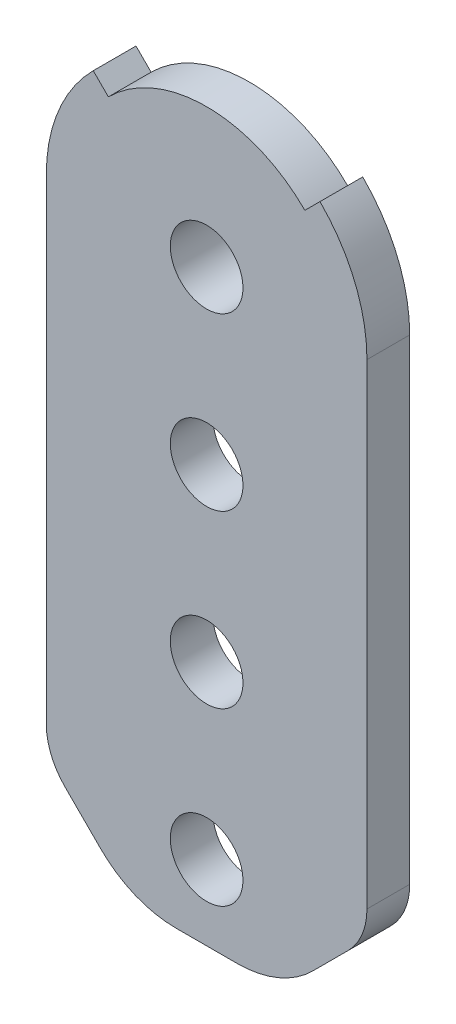
from build123d import *
from build123d.topology import SkipClean

# Parameters (mm, degrees)
SKETCH1_R                 = 1.7
BOSS_EXTRUDE1_DEPTH       = 2
BOSS_EXTRUDE2_START       = -4.3
BOSS_EXTRUDE2_DEPTH       = 4.3
BOSS_EXTRUDE3_START       = 2
BOSS_EXTRUDE3_DEPTH       = 2
SKETCH3_R                 = 1.7
CUT_EXTRUDE2_DEPTH        = 2
FILLET1_R                 = 0.5
FILLET2_R                 = 0.5
FILLET3_R                 = 1.5
FILLET4_R                 = 0.5
SKETCH5_R                 = 15.029475961
CUT_EXTRUDE3_DEPTH        = 10
CUT_EXTRUDE4_DEPTH        = 10
BOSS_EXTRUDE4_START       = 0.5
SKETCH7_R                 = 2.25
SKETCH7_R_2               = 1.7
BOSS_EXTRUDE4_DEPTH       = 0.5
CHAMFER2_SIZE             = 0.5
CUT_EXTRUDE7_DEPTH        = 31.987900865
BOSS_EXTRUDE5_DEPTH       = 2
FILLET7_R                 = 5
FILLET8_R                 = 1
FILLET9_R                 = 3
BOSS_EXTRUDE6_START       = -2
BOSS_EXTRUDE6_OUTLINE_R   = 1.7
BOSS_EXTRUDE6_OUTLINE_R_2 = 2.75
BOSS_EXTRUDE6_DEPTH       = 2


with BuildPart() as part:
    # Sketch1 → Boss-Extrude1 (new body)
    with BuildSketch(Plane.XY):
        with BuildLine():
            Line((-7.5, 0), (-7.5, -30))
            Line((-7.5, -30), (7.5, -30))
            Line((7.5, -30), (7.5, 0))
            ThreePointArc((7.5, 0), (0, 7.5), (-7.5, 0))
        make_face()
        Circle(SKETCH1_R, mode=Mode.SUBTRACT)
    extrude(amount=BOSS_EXTRUDE1_DEPTH)

    # Sketch1<3> → Boss-Extrude2 (add)
    with BuildSketch(Plane.XY.offset(BOSS_EXTRUDE2_START)):
        with BuildLine():
            ThreePointArc((5.303300859, 5.303300859), (0, 7.5), (-5.303300859, 5.303300859))
            Line((-5.303300859, 5.303300859), (-4.419417382, 4.419417382))
            ThreePointArc((-4.419417382, 4.419417382), (0, 6.25), (4.419417382, 4.419417382))
            Line((4.419417382, 4.419417382), (5.303300859, 5.303300859))
        make_face()
    extrude(amount=BOSS_EXTRUDE2_DEPTH)

    # Sketch2 → Boss-Extrude3 (add)
    with BuildSketch(Plane(origin=(0, 0, -4.3), x_dir=(-1, 0, 0), z_dir=(0, 0, -1)).offset(BOSS_EXTRUDE3_START)):
        with BuildLine():
            ThreePointArc((-0.842733725, 2.879201255), (-2.631805464, 1.44), (-2.879201255, -0.842733725))
            ThreePointArc((-2.879201255, -0.842733725), (0, -3), (2.879201255, -0.842733725))
            ThreePointArc((2.879201255, -0.842733725), (2.969646761, -0.425673721), (3, 0))
            ThreePointArc((3, 0), (2.400854137, 1.798860587), (0.842733725, 2.879201255))
            Line((0.842733725, 2.879201255), (0.477549111, 1.631547378))
            ThreePointArc((0.477549111, 1.631547378), (1.360484011, 1.019354333), (1.7, 0))
            ThreePointArc((1.7, 0), (-1.019354333, -1.360484011), (-0.477549111, 1.631547378))
            Line((-0.477549111, 1.631547378), (-0.842733725, 2.879201255))
        make_face()
        with BuildLine():
            ThreePointArc((0.842733725, 2.879201255), (0, 3), (-0.842733725, 2.879201255))
            Line((-0.842733725, 2.879201255), (-0.477549111, 1.631547378))
            ThreePointArc((-0.477549111, 1.631547378), (0, 1.7), (0.477549111, 1.631547378))
            Line((0.477549111, 1.631547378), (0.842733725, 2.879201255))
        make_face()
        with BuildLine():
            ThreePointArc((-1.755695261, 5.998335948), (-3.186887196, 5.376453292), (-4.419417382, 4.419417382))
            Line((-4.419417382, 4.419417382), (-2.879201255, -0.842733725))
            ThreePointArc((-2.879201255, -0.842733725), (-2.631805464, 1.44), (-0.842733725, 2.879201255))
            Line((-0.842733725, 2.879201255), (-1.755695261, 5.998335948))
        make_face()
        with BuildLine():
            ThreePointArc((3, 0), (2.969646761, -0.425673721), (2.879201255, -0.842733725))
            Line((2.879201255, -0.842733725), (4.419417382, 4.419417382))
            ThreePointArc((4.419417382, 4.419417382), (3.186887196, 5.376453292), (1.755695261, 5.998335948))
            Line((1.755695261, 5.998335948), (0.842733725, 2.879201255))
            ThreePointArc((0.842733725, 2.879201255), (2.400854137, 1.798860587), (3, 0))
        make_face()
        with BuildLine():
            Line((-5.303300859, 5.303300859), (-4.419417382, 4.419417382))
            ThreePointArc((-4.419417382, 4.419417382), (-3.186887196, 5.376453292), (-1.755695261, 5.998335948))
            ThreePointArc((-1.755695261, 5.998335948), (0, 6.25), (1.755695261, 5.998335948))
            ThreePointArc((1.755695261, 5.998335948), (3.186887196, 5.376453292), (4.419417382, 4.419417382))
            Line((4.419417382, 4.419417382), (5.303300859, 5.303300859))
            ThreePointArc((5.303300859, 5.303300859), (0, 7.5), (-5.303300859, 5.303300859))
        make_face()
    extrude(amount=-BOSS_EXTRUDE3_DEPTH)

    # Sketch3 → Cut-Extrude2 (cut)
    with BuildSketch(Plane(origin=(0, 0, 0), x_dir=(-1, 0, 0), z_dir=(0, 0, -1))):
        with Locations((0, -8)):
            Circle(SKETCH3_R)
        with Locations((0, -16)):
            Circle(SKETCH3_R)
        with Locations((0, -24)):
            Circle(SKETCH3_R)
        Polygon((-6, -18.5), (-3.1875, -20), (-6, -21.5), align=None)
        Polygon((-6, -10.5), (-3.1875, -12), (-6, -13.5), align=None)
        Polygon((6, -13.5), (3.1875, -12), (6, -10.5), align=None)
        Polygon((6, -21.5), (3.1875, -20), (6, -18.5), align=None)
    extrude(amount=-CUT_EXTRUDE2_DEPTH, mode=Mode.SUBTRACT)

    # Fillet1
    fillet1_edges = [part.edges().sort_by_distance(p)[0] for p in [
        (-3.1875, -20, 1),
        (-6, -18.5, 1),
        (6, -18.5, 1),
        (3.1875, -20, 1),
        (6, -21.5, 1),
        (6, -10.5, 1),
        (3.1875, -12, 1),
        (6, -13.5, 1),
        (-6, -13.5, 1),
        (-3.1875, -12, 1),
        (-6, -10.5, 1),
        (-6, -21.5, 1),
    ]]
    fillet(fillet1_edges, radius=FILLET1_R)

    # Fillet2
    fillet2_edges = [part.edges().sort_by_distance(p)[0] for p in [
        (5.303300859, 5.303300859, -3.15),
        (4.419417382, 4.419417382, -2.15),
        (-4.419417382, 4.419417382, -2.15),
        (-5.303300859, 5.303300859, -3.15),
    ]]
    fillet(fillet2_edges, radius=FILLET2_R)

    # Fillet3
    fillet3_edges = [part.edges().sort_by_distance(p)[0] for p in [
        (-4.419417382, 4.419417382, -5.3),
        (4.419417382, 4.419417382, -5.3),
    ]]
    fillet(fillet3_edges, radius=FILLET3_R)

    # Fillet4
    fillet4_edges = [part.edges().sort_by_distance(p)[0] for p in [
        (-0.842733725, 2.879201255, -5.3),
        (0.842733725, 2.879201255, -5.3),
        (1.755695261, 5.998335948, -5.3),
        (-1.755695261, 5.998335948, -5.3),
    ]]
    fillet(fillet4_edges, radius=FILLET4_R)

    # Sketch5 → Cut-Extrude3 (cut)
    with BuildSketch(Plane(origin=(0, 0, 0), x_dir=(-1, 0, 0), z_dir=(0, 0, -1))):
        Circle(SKETCH5_R)
    extrude(amount=CUT_EXTRUDE3_DEPTH, mode=Mode.SUBTRACT)

    # Sketch6 → Cut-Extrude4 (cut)
    with BuildSketch(Plane(origin=(0, 0, 0), x_dir=(-1, 0, 0), z_dir=(0, 0, -1))):
        with BuildLine():
            Line((-5.303300859, 5.303300859), (-4.596194078, 4.596194078))
            ThreePointArc((-4.596194078, 4.596194078), (0, 6.5), (4.596194078, 4.596194078))
            Line((4.596194078, 4.596194078), (5.303300859, 5.303300859))
            ThreePointArc((5.303300859, 5.303300859), (0, 7.5), (-5.303300859, 5.303300859))
        make_face()
    extrude(amount=-CUT_EXTRUDE4_DEPTH, mode=Mode.SUBTRACT)

    # Sketch7 → Boss-Extrude4 (add)
    with SkipClean():  # the faces are left unmerged after this step: merging them gives an invalid solid
        with BuildSketch(Plane(origin=(0, 0, 0), x_dir=(-1, 0, 0), z_dir=(0, 0, -1)).offset(BOSS_EXTRUDE4_START)):
            with Locations(Location((0, 0, 0), (0, 0, 180))):
                Circle(SKETCH7_R)
            Circle(SKETCH7_R_2, mode=Mode.SUBTRACT)
        extrude(amount=-BOSS_EXTRUDE4_DEPTH)

    # Chamfer2
    chamfer2_edges = [part.edges().sort_by_distance(p)[0] for p in [
        (-2.25, 0, 0),
    ]]
    chamfer(chamfer2_edges, length=CHAMFER2_SIZE - 0.0001)  # a hair under: the kernel refuses the full size

    # Sketch4 → Cut-Extrude7 (cut, through all)
    # profile 1 of 3: a face of its own
    with BuildSketch(Plane(origin=(0, 0, 0), x_dir=(-1, 0, 0), z_dir=(0, 0, -1))):
        with BuildLine():
            Line((-4.014705882, -20.441176471), (-3.5, -20.166666667))
            Line((-3.5, -20.166666667), (-3.5, -11.833333333))
            Line((-3.5, -11.833333333), (-3.5, -5.7))
            Line((-3.5, -5.7), (-7.5, -1.7))
            Line((-7.5, -1.7), (-7.5, -22.3))
            Line((-7.5, -22.3), (-5.264705882, -21.107843137))
            ThreePointArc((-5.264705882, -21.107843137), (-5.757247878, -21.09541313), (-6, -20.666666667))
            Line((-6, -20.666666667), (-6, -19.333333333))
            ThreePointArc((-6, -19.333333333), (-5.757247878, -18.90458687), (-5.264705882, -18.892156863))
            Line((-5.264705882, -18.892156863), (-4.014705882, -19.558823529))
            ThreePointArc((-4.014705882, -19.558823529), (-3.75, -20), (-4.014705882, -20.441176471))
        make_face()
        with BuildLine():
            ThreePointArc((-5.264705882, -13.107843137), (-5.757247878, -13.09541313), (-6, -12.666666667))
            Line((-6, -12.666666667), (-6, -11.333333333))
            ThreePointArc((-6, -11.333333333), (-5.757247878, -10.90458687), (-5.264705882, -10.892156863))
            Line((-5.264705882, -10.892156863), (-4.014705882, -11.558823529))
            ThreePointArc((-4.014705882, -11.558823529), (-3.75, -12), (-4.014705882, -12.441176471))
            Line((-4.014705882, -12.441176471), (-5.264705882, -13.107843137))
        make_face(mode=Mode.SUBTRACT)
    # profile 2 of 3: a face of its own
    with BuildSketch(Plane(origin=(0, 0, 0), x_dir=(-1, 0, 0), z_dir=(0, 0, -1))):
        with BuildLine():
            Line((-3.5, -24), (-3.5, -20.166666667))
            Line((-3.5, -20.166666667), (-4.014705882, -20.441176471))
            Line((-4.014705882, -20.441176471), (-5.264705882, -21.107843137))
            Line((-5.264705882, -21.107843137), (-7.5, -22.3))
            Line((-7.5, -22.3), (-7.5, -30))
            Line((-7.5, -30), (7.5, -30))
            Line((7.5, -30), (7.5, -22.3))
            Line((7.5, -22.3), (5.264705882, -21.107843137))
            Line((5.264705882, -21.107843137), (4.014705882, -20.441176471))
            Line((4.014705882, -20.441176471), (3.5, -20.166666667))
            Line((3.5, -20.166666667), (3.5, -24))
            ThreePointArc((3.5, -24), (0, -27.5), (-3.5, -24))
        make_face()
    # profile 3 of 3: a face of its own
    with BuildSketch(Plane(origin=(0, 0, 0), x_dir=(-1, 0, 0), z_dir=(0, 0, -1))):
        with BuildLine():
            Line((3.5, -11.833333333), (3.5, -20.166666667))
            Line((3.5, -20.166666667), (4.014705882, -20.441176471))
            ThreePointArc((4.014705882, -20.441176471), (3.75, -20), (4.014705882, -19.558823529))
            Line((4.014705882, -19.558823529), (5.264705882, -18.892156863))
            ThreePointArc((5.264705882, -18.892156863), (5.757247878, -18.90458687), (6, -19.333333333))
            Line((6, -19.333333333), (6, -20.666666667))
            ThreePointArc((6, -20.666666667), (5.757247878, -21.09541313), (5.264705882, -21.107843137))
            Line((5.264705882, -21.107843137), (7.5, -22.3))
            Line((7.5, -22.3), (7.5, -1.7))
            Line((7.5, -1.7), (3.5, -5.7))
            Line((3.5, -5.7), (3.5, -11.833333333))
        make_face()
        with BuildLine():
            ThreePointArc((5.264705882, -10.892156863), (5.757247878, -10.90458687), (6, -11.333333333))
            Line((6, -11.333333333), (6, -12.666666667))
            ThreePointArc((6, -12.666666667), (5.757247878, -13.09541313), (5.264705882, -13.107843137))
            Line((5.264705882, -13.107843137), (4.014705882, -12.441176471))
            ThreePointArc((4.014705882, -12.441176471), (3.75, -12), (4.014705882, -11.558823529))
            Line((4.014705882, -11.558823529), (5.264705882, -10.892156863))
        make_face(mode=Mode.SUBTRACT)
    extrude(amount=-CUT_EXTRUDE7_DEPTH, mode=Mode.SUBTRACT)

    # Sketch9 → Boss-Extrude5 (add)
    # profile 1 of 2: a face of its own
    with BuildSketch(Plane(origin=(0, 0, 0), x_dir=(-1, 0, 0), z_dir=(0, 0, -1))):
        with BuildLine():
            Line((-3.5, -5.7), (-7.5, -1.7))
            Line((-7.5, -1.7), (-7.5, -23.5))
            Line((-7.5, -23.5), (-3.5, -27.5))
            Line((-3.5, -27.5), (0, -27.5))
            ThreePointArc((0, -27.5), (-2.474873734, -26.474873734), (-3.5, -24))
            Line((-3.5, -24), (-3.5, -5.7))
        make_face()
        Polygon((-4.5, -6.114213562), (-4.5, -25.085786438), (-6.5, -23.085786438), (-6.5, -4.114213562), align=None, mode=Mode.SUBTRACT)
    # profile 2 of 2: a face of its own
    with BuildSketch(Plane(origin=(0, 0, 0), x_dir=(-1, 0, 0), z_dir=(0, 0, -1))):
        with BuildLine():
            ThreePointArc((3.5, -24), (2.474873734, -26.474873734), (0, -27.5))
            Line((0, -27.5), (3.5, -27.5))
            Line((3.5, -27.5), (7.5, -23.5))
            Line((7.5, -23.5), (7.5, -1.7))
            Line((7.5, -1.7), (3.5, -5.7))
            Line((3.5, -5.7), (3.5, -24))
        make_face()
        Polygon((4.5, -6.114213562), (6.5, -4.114213562), (6.5, -23.085786438), (4.5, -25.085786438), align=None, mode=Mode.SUBTRACT)
    extrude(amount=-BOSS_EXTRUDE5_DEPTH)

    # Fillet7
    fillet7_edges = [part.edges().sort_by_distance(p)[0] for p in [
        (-3.5, -27.5, 1),
        (3.5, -27.5, 1),
    ]]
    fillet(fillet7_edges, radius=FILLET7_R)

    # Fillet8
    fillet8_edges = [part.edges().sort_by_distance(p)[0] for p in [
        (4.5, -25.085786438, 1),
        (6.5, -23.085786438, 1),
        (6.5, -4.114213562, 1),
        (4.5, -6.114213562, 1),
        (-4.5, -6.114213562, 1),
        (-6.5, -4.114213562, 1),
        (-6.5, -23.085786438, 1),
        (-4.5, -25.085786438, 1),
    ]]
    fillet(fillet8_edges, radius=FILLET8_R - 0.0001)  # a hair under: the kernel refuses the full size

    # Fillet9
    fillet9_edges = [part.edges().sort_by_distance(p)[0] for p in [
        (-7.5, -23.5, 1),
        (7.5, -23.5, 1),
    ]]
    fillet(fillet9_edges, radius=FILLET9_R)

    # Boss-Extrude6: read off the stored shape, not the designer's step
    # Boss-Extrude6 outline → Boss-Extrude6 (add)
    with BuildSketch(Plane(origin=(0, 0, 0), x_dir=(-1, 0, 0), z_dir=(0, 0, -1)).offset(BOSS_EXTRUDE6_START)):
        with BuildLine():
            ThreePointArc((1.428932188, -27.5), (3.34234935, -27.119397663), (4.964466094, -26.035533906))
            Line((4.964466094, -26.035533906), (6.621320344, -24.378679656))
            ThreePointArc((6.621320344, -24.378679656), (7.271638598, -23.40540961), (7.5, -22.257359313))
            Line((7.5, -22.257359313), (7.5, 0))
            ThreePointArc((7.5, 0), (6.929096494, 2.870125743), (5.303300859, 5.303300859))
            Line((5.303300859, 5.303300859), (4.596194078, 4.596194078))
            ThreePointArc((4.596194078, 4.596194078), (0, 6.5), (-4.596194078, 4.596194078))
            Line((-4.596194078, 4.596194078), (-5.303300859, 5.303300859))
            ThreePointArc((-5.303300859, 5.303300859), (-6.929096494, 2.870125743), (-7.5, 0))
            Line((-7.5, 0), (-7.5, -22.257359313))
            ThreePointArc((-7.5, -22.257359313), (-7.271638598, -23.40540961), (-6.621320344, -24.378679656))
            Line((-6.621320344, -24.378679656), (-4.964466094, -26.035533906))
            ThreePointArc((-4.964466094, -26.035533906), (-3.34234935, -27.119397663), (-1.428932188, -27.5))
            Line((-1.428932188, -27.5), (1.428932188, -27.5))
        make_face()
        with Locations((0, -24)):
            Circle(BOSS_EXTRUDE6_OUTLINE_R, mode=Mode.SUBTRACT)
        with Locations((0, -16)):
            Circle(BOSS_EXTRUDE6_OUTLINE_R, mode=Mode.SUBTRACT)
        with Locations((0, -8)):
            Circle(BOSS_EXTRUDE6_OUTLINE_R, mode=Mode.SUBTRACT)
        Circle(BOSS_EXTRUDE6_OUTLINE_R_2, mode=Mode.SUBTRACT)
    extrude(amount=BOSS_EXTRUDE6_DEPTH)


solid = part.part
